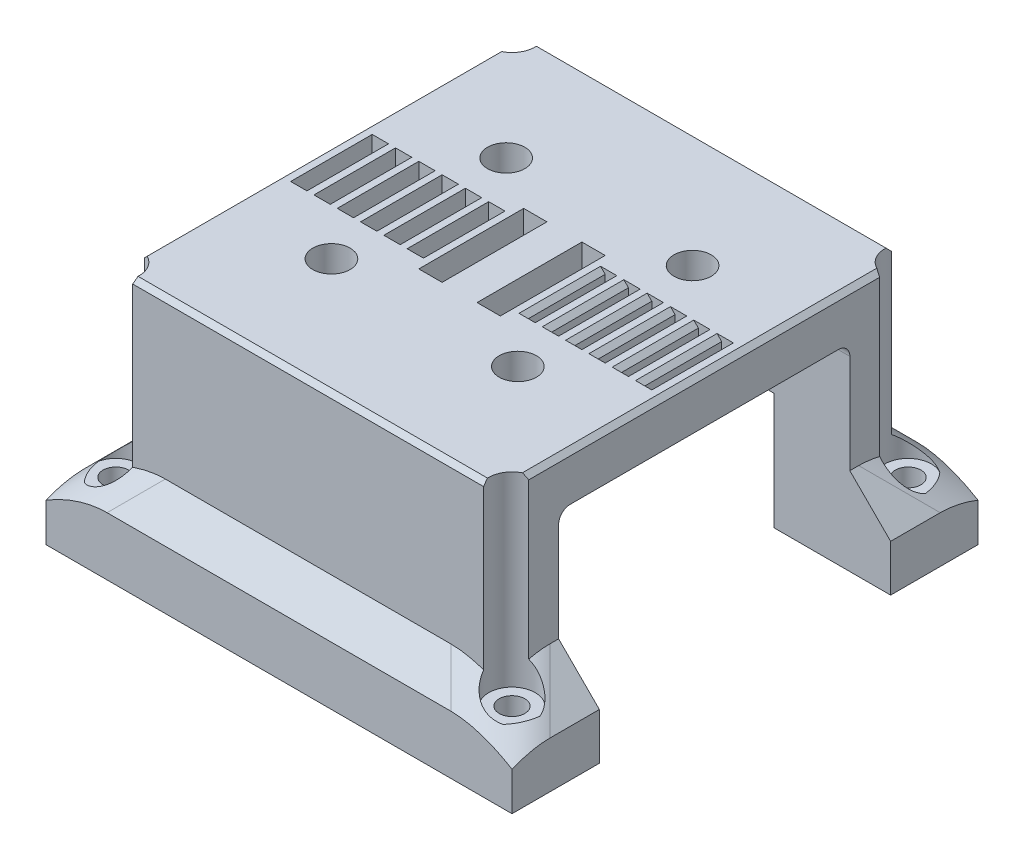
from build123d import *
from build123d.topology import SkipClean

# Parameters (mm, degrees)
SKETCH_1_W          = 33
SKETCH_1_H          = 35
SKETCH_1_R          = 1.6
EXTRUDE_1_DEPTH     = 4
SKETCH_2_W          = 1
SKETCH_2_H          = 7
CUT_EXTRUDE_1_DEPTH = 1.5
CHAMFER_1_SIZE      = 0.4
SKETCH_3_W          = 2
SKETCH_3_H          = 9
CUT_EXTRUDE_2_DEPTH = 49.270073545
SKETCH_4_W          = 3
SKETCH_4_H          = 7
EXTRUDE_2_DEPTH     = 1.5
SKETCH_5_W          = 33
SKETCH_5_H          = 5
EXTRUDE_3_DEPTH     = 13
SKETCH_7_W          = 40
SKETCH_7_H          = 7.5
EXTRUDE_4_DEPTH     = 4
CHAMFER_4_SIZE      = 3.5
SKETCH_8_R          = 1.1
CUT_EXTRUDE_3_DEPTH = 10
FILLET_1_R          = 1
SKETCH_9_W          = 20
SKETCH_9_H          = 7.5
CUT_EXTRUDE_4_DEPTH = 10
SKETCH_10_R         = 2
CUT_EXTRUDE_5_DEPTH = 16
CHAMFER_3_SIZE      = 0.4
FILLET_2_R          = 6


with BuildPart() as part:
    # 草图1 → 凸台-拉伸1 (new body)
    with BuildSketch(Plane(origin=(0, 0, 0), x_dir=(1, 0, 0), z_dir=(0, 1, 0))):
        with Locations((16.5, -17.5)):
            Rectangle(SKETCH_1_W, SKETCH_1_H)
        with Locations(Location((8.5, -10, 0), (0, 0, 270))):
            Circle(SKETCH_1_R, mode=Mode.SUBTRACT)
        with Locations(Location((24.5, -10, 0), (0, 0, 270))):
            Circle(SKETCH_1_R, mode=Mode.SUBTRACT)
        with Locations(Location((24.5, -25, 0), (0, 0, 270))):
            Circle(SKETCH_1_R, mode=Mode.SUBTRACT)
        with Locations(Location((8.5, -25, 0), (0, 0, 270))):
            Circle(SKETCH_1_R, mode=Mode.SUBTRACT)
    extrude(amount=EXTRUDE_1_DEPTH)

    # 草图2 → 切除-拉伸1 (cut)
    with BuildSketch(Plane(origin=(0, 4, 0), x_dir=(1, 0, 0), z_dir=(0, 1, 0))):
        with Locations((1.5, -17.5)):
            Rectangle(SKETCH_2_W, SKETCH_2_H)
        with Locations((3.5, -17.5)):
            Rectangle(SKETCH_2_W, SKETCH_2_H)
        with Locations((5.5, -17.5)):
            Rectangle(SKETCH_2_W, SKETCH_2_H)
        with Locations((7.5, -17.5)):
            Rectangle(SKETCH_2_W, SKETCH_2_H)
        with Locations((9.5, -17.5)):
            Rectangle(SKETCH_2_W, SKETCH_2_H)
        with Locations((11.5, -17.5)):
            Rectangle(SKETCH_2_W, SKETCH_2_H)
        with Locations((13.5, -17.5)):
            Rectangle(SKETCH_2_W, SKETCH_2_H)
        with Locations((15.5, -17.5)):
            Rectangle(SKETCH_2_W, SKETCH_2_H)
        with Locations((17.5, -17.5)):
            Rectangle(SKETCH_2_W, SKETCH_2_H)
        with Locations((19.5, -17.5)):
            Rectangle(SKETCH_2_W, SKETCH_2_H)
        with Locations((21.5, -17.5)):
            Rectangle(SKETCH_2_W, SKETCH_2_H)
        with Locations((23.5, -17.5)):
            Rectangle(SKETCH_2_W, SKETCH_2_H)
        with Locations((25.5, -17.5)):
            Rectangle(SKETCH_2_W, SKETCH_2_H)
        with Locations((27.5, -17.5)):
            Rectangle(SKETCH_2_W, SKETCH_2_H)
        with Locations((29.5, -17.5)):
            Rectangle(SKETCH_2_W, SKETCH_2_H)
        with Locations((31.5, -17.5)):
            Rectangle(SKETCH_2_W, SKETCH_2_H)
    extrude(amount=-CUT_EXTRUDE_1_DEPTH, mode=Mode.SUBTRACT)

    # 倒角1
    chamfer_1_edges = [part.edges().sort_by_distance(p)[0] for p in [
        (14, 4, 17.5),
        (16, 4, 17.5),
        (17, 4, 17.5),
        (19, 4, 17.5),
        (21, 4, 17.5),
        (23, 4, 17.5),
        (25, 4, 17.5),
        (27, 4, 17.5),
        (29, 4, 17.5),
        (31, 4, 17.5),
        (2, 4, 17.5),
        (4, 4, 17.5),
        (6, 4, 17.5),
        (8, 4, 17.5),
        (10, 4, 17.5),
        (12, 4, 17.5),
    ]]
    chamfer(chamfer_1_edges, length=CHAMFER_1_SIZE)

    # 草图3 → 切除-拉伸2 (cut, through all)
    with BuildSketch(Plane(origin=(0, 4, 0), x_dir=(1, 0, 0), z_dir=(0, 1, 0))):
        with Locations((14, -17.5)):
            Rectangle(SKETCH_3_W, SKETCH_3_H)
        with Locations((19, -17.5)):
            Rectangle(SKETCH_3_W, SKETCH_3_H)
    extrude(amount=-CUT_EXTRUDE_2_DEPTH, mode=Mode.SUBTRACT)

    # 草图4 → 凸台-拉伸2 (add)
    with BuildSketch(Plane(origin=(0, 4, 0), x_dir=(1, 0, 0), z_dir=(0, 1, 0))):
        with Locations((16.5, -17.5)):
            Rectangle(SKETCH_4_W, SKETCH_4_H)
    extrude(amount=-EXTRUDE_2_DEPTH)

    # 草图5 → 凸台-拉伸3 (add)
    with BuildSketch(Plane(origin=(0, 0, 0), x_dir=(-1, 0, 0), z_dir=(0, -1, 0))):
        with Locations((-16.5, -32.5)):
            Rectangle(SKETCH_5_W, SKETCH_5_H)
        with Locations((-16.5, -2.5)):
            Rectangle(SKETCH_5_W, SKETCH_5_H)
    extrude(amount=EXTRUDE_3_DEPTH)

    # 草图7 → 凸台-拉伸4 (add)
    with BuildSketch(Plane(origin=(0, -13, 0), x_dir=(-1, 0, 0), z_dir=(0, -1, 0))):
        with Locations((-16.5, -33.75)):
            Rectangle(SKETCH_7_W, SKETCH_7_H)
        with Locations((-16.5, -1.25)):
            Rectangle(SKETCH_7_W, SKETCH_7_H)
    extrude(amount=EXTRUDE_4_DEPTH)

    # 倒角4
    # the kernel refuses this chamfer: 3.5 mm, written as the material it adds along each edge
    with BuildSketch(Plane(origin=(33, -13, 5), x_dir=(-0.027495876610586112, 0.9996219169112968, 0), z_dir=(0, 0, -1))) as chamfer_4_piece_1_section:
        Polygon((CHAMFER_4_SIZE * 0.999621916911, CHAMFER_4_SIZE * 0.0274958766106), (-CHAMFER_4_SIZE * 0.0274958766106, CHAMFER_4_SIZE * 0.999621916911), (0, 0), align=None)
    chamfer_4_piece_1 = extrude(amount=5, mode=Mode.PRIVATE)
    chamfer_4_piece_1 = split(chamfer_4_piece_1, bisect_by=Plane(origin=(36.5, -11.84358546, 2.5), z_dir=(-1, 0, 0)), keep=Keep.TOP, mode=Mode.PRIVATE)
    add(chamfer_4_piece_1)
    with BuildSketch(Plane(origin=(33, -13, 0), x_dir=(0, 0.9996219169112968, 0.02749587661058637), z_dir=(-1, 0, 0))) as chamfer_4_piece_2_section:
        Polygon((CHAMFER_4_SIZE * 0.999621916911, CHAMFER_4_SIZE * 0.0274958766106), (-CHAMFER_4_SIZE * 0.0274958766106, CHAMFER_4_SIZE * 0.999621916911), (0, 0), align=None)
    chamfer_4_piece_2 = extrude(amount=33, mode=Mode.PRIVATE)
    chamfer_4_piece_2 = split(chamfer_4_piece_2, bisect_by=Plane(origin=(16.5, -11.750880098, -2.5), z_dir=(0, 0, 1)), keep=Keep.TOP, mode=Mode.PRIVATE)
    add(chamfer_4_piece_2)
    with BuildSketch(Plane(origin=(0, -13, 0), x_dir=(0.027495876610586126, 0.9996219169112968, 0), z_dir=(0, 0, 1))) as chamfer_4_piece_3_section:
        Polygon((CHAMFER_4_SIZE * 0.999621916911, CHAMFER_4_SIZE * 0.0274958766106), (-CHAMFER_4_SIZE * 0.0274958766106, CHAMFER_4_SIZE * 0.999621916911), (0, 0), align=None)
    chamfer_4_piece_3 = extrude(amount=5, mode=Mode.PRIVATE)
    chamfer_4_piece_3 = split(chamfer_4_piece_3, bisect_by=Plane(origin=(-3.5, -11.84358546, 2.5), z_dir=(1, 0, 0)), keep=Keep.TOP, mode=Mode.PRIVATE)
    add(chamfer_4_piece_3)
    with BuildSketch(Plane(origin=(33, -13, 35), x_dir=(0.9996219169112968, -0.02749587661058662, 0), z_dir=(0, 0, -1))) as chamfer_4_piece_4_section:
        Polygon((CHAMFER_4_SIZE * 0.999621916911, -CHAMFER_4_SIZE * 0.0274958766106), (-CHAMFER_4_SIZE * 0.0274958766106, -CHAMFER_4_SIZE * 0.999621916911), (0, 0), align=None)
    chamfer_4_piece_4 = extrude(amount=5, mode=Mode.PRIVATE)
    chamfer_4_piece_4 = split(chamfer_4_piece_4, bisect_by=Plane(origin=(36.5, -11.84358546, 32.5), z_dir=(-1, 0, 0)), keep=Keep.TOP, mode=Mode.PRIVATE)
    add(chamfer_4_piece_4)
    with BuildSketch(Plane(origin=(0, -13, 30), x_dir=(-0.9996219169112968, -0.02749587661058612, 0), z_dir=(0, 0, 1))) as chamfer_4_piece_5_section:
        Polygon((CHAMFER_4_SIZE * 0.999621916911, -CHAMFER_4_SIZE * 0.0274958766106), (-CHAMFER_4_SIZE * 0.0274958766106, -CHAMFER_4_SIZE * 0.999621916911), (0, 0), align=None)
    chamfer_4_piece_5 = extrude(amount=5, mode=Mode.PRIVATE)
    chamfer_4_piece_5 = split(chamfer_4_piece_5, bisect_by=Plane(origin=(-3.5, -11.84358546, 32.5), z_dir=(1, 0, 0)), keep=Keep.TOP, mode=Mode.PRIVATE)
    add(chamfer_4_piece_5)
    with BuildSketch(Plane(origin=(0, -13, 35), x_dir=(0, -0.02749587661058662, 0.9996219169112968), z_dir=(1, 0, 0))) as chamfer_4_piece_6_section:
        Polygon((CHAMFER_4_SIZE * 0.999621916911, -CHAMFER_4_SIZE * 0.0274958766106), (-CHAMFER_4_SIZE * 0.0274958766106, -CHAMFER_4_SIZE * 0.999621916911), (0, 0), align=None)
    chamfer_4_piece_6 = extrude(amount=33, mode=Mode.PRIVATE)
    chamfer_4_piece_6 = split(chamfer_4_piece_6, bisect_by=Plane(origin=(16.5, -11.750880098, 37.5), z_dir=(0, 0, -1)), keep=Keep.TOP, mode=Mode.PRIVATE)
    add(chamfer_4_piece_6)
    with BuildSketch(Plane(origin=(33, -13, 5), x_dir=(-0.027495876610586112, 0.9996219169112968, 0), z_dir=(0, 0, -1))) as chamfer_4_piece_7a_section:
        Polygon((CHAMFER_4_SIZE * 0.999621916911, CHAMFER_4_SIZE * 0.0274958766106), (-CHAMFER_4_SIZE * 0.0274958766106, CHAMFER_4_SIZE * 0.999621916911), (0, 0), align=None)
    chamfer_4_piece_7a = extrude(amount=14.000890458, mode=Mode.PRIVATE)
    chamfer_4_piece_7a = split(chamfer_4_piece_7a, bisect_by=Plane(origin=(34.150220168, -11.84358546, 0), z_dir=(0, 0, -1)), keep=Keep.TOP, mode=Mode.PRIVATE)
    chamfer_4_piece_7a = split(chamfer_4_piece_7a, bisect_by=Plane(origin=(36.5, -11.84358546, -1.25), z_dir=(-1, 0, 0)), keep=Keep.TOP, mode=Mode.PRIVATE)
    chamfer_4_piece_7a = split(chamfer_4_piece_7a, bisect_by=Plane(origin=(34.150220168, -11.84358546, -2.5), z_dir=(0, 0, 1)), keep=Keep.TOP, mode=Mode.PRIVATE)
    with BuildSketch(Plane(origin=(42.000890458, -13, 0), x_dir=(0, 0.9996219169112968, 0.02749587661058637), z_dir=(-1, 0, 0))) as chamfer_4_piece_7b_section:
        Polygon((CHAMFER_4_SIZE * 0.999621916911, CHAMFER_4_SIZE * 0.0274958766106), (-CHAMFER_4_SIZE * 0.0274958766106, CHAMFER_4_SIZE * 0.999621916911), (0, 0), align=None)
    chamfer_4_piece_7b = extrude(amount=42.000890458, mode=Mode.PRIVATE)
    chamfer_4_piece_7b = split(chamfer_4_piece_7b, bisect_by=Plane(origin=(33, -11.750880098, -0.973158105), z_dir=(1, 0, 0)), keep=Keep.TOP, mode=Mode.PRIVATE)
    chamfer_4_piece_7b = split(chamfer_4_piece_7b, bisect_by=Plane(origin=(36.5, -11.750880098, -0.973158105), z_dir=(-1, 0, 0)), keep=Keep.TOP, mode=Mode.PRIVATE)
    chamfer_4_piece_7b = split(chamfer_4_piece_7b, bisect_by=Plane(origin=(34.75, -11.750880098, -2.5), z_dir=(0, 0, 1)), keep=Keep.TOP, mode=Mode.PRIVATE)
    chamfer_4_piece_7 = chamfer_4_piece_7a & chamfer_4_piece_7b
    add(chamfer_4_piece_7)
    with BuildSketch(Plane(origin=(0, -13, -9.000890458), x_dir=(0.02749587661058636, 0.9996219169112968, 0), z_dir=(0, 0, 1))) as chamfer_4_piece_8a_section:
        Polygon((CHAMFER_4_SIZE * 0.999621916911, CHAMFER_4_SIZE * 0.0274958766106), (-CHAMFER_4_SIZE * 0.0274958766106, CHAMFER_4_SIZE * 0.999621916911), (0, 0), align=None)
    chamfer_4_piece_8a = extrude(amount=14.000890458, mode=Mode.PRIVATE)
    chamfer_4_piece_8a = split(chamfer_4_piece_8a, bisect_by=Plane(origin=(-1.150220168, -11.84358546, 0), z_dir=(0, 0, -1)), keep=Keep.TOP, mode=Mode.PRIVATE)
    chamfer_4_piece_8a = split(chamfer_4_piece_8a, bisect_by=Plane(origin=(-3.5, -11.84358546, -1.25), z_dir=(1, 0, 0)), keep=Keep.TOP, mode=Mode.PRIVATE)
    chamfer_4_piece_8a = split(chamfer_4_piece_8a, bisect_by=Plane(origin=(-1.150220168, -11.84358546, -2.5), z_dir=(0, 0, 1)), keep=Keep.TOP, mode=Mode.PRIVATE)
    with BuildSketch(Plane(origin=(33, -13, 0), x_dir=(0, 0.9996219169112968, 0.02749587661058637), z_dir=(-1, 0, 0))) as chamfer_4_piece_8b_section:
        Polygon((CHAMFER_4_SIZE * 0.999621916911, CHAMFER_4_SIZE * 0.0274958766106), (-CHAMFER_4_SIZE * 0.0274958766106, CHAMFER_4_SIZE * 0.999621916911), (0, 0), align=None)
    chamfer_4_piece_8b = extrude(amount=42.000890458, mode=Mode.PRIVATE)
    chamfer_4_piece_8b = split(chamfer_4_piece_8b, bisect_by=Plane(origin=(0, -11.750880098, -0.973158105), z_dir=(-1, 0, 0)), keep=Keep.TOP, mode=Mode.PRIVATE)
    chamfer_4_piece_8b = split(chamfer_4_piece_8b, bisect_by=Plane(origin=(-3.5, -11.750880098, -0.973158105), z_dir=(1, 0, 0)), keep=Keep.TOP, mode=Mode.PRIVATE)
    chamfer_4_piece_8b = split(chamfer_4_piece_8b, bisect_by=Plane(origin=(-1.75, -11.750880098, -2.5), z_dir=(0, 0, 1)), keep=Keep.TOP, mode=Mode.PRIVATE)
    chamfer_4_piece_8 = chamfer_4_piece_8a & chamfer_4_piece_8b
    add(chamfer_4_piece_8)
    with BuildSketch(Plane(origin=(0, -13, 35), x_dir=(0, -0.02749587661058662, 0.9996219169112968), z_dir=(1, 0, 0))) as chamfer_4_piece_9a_section:
        Polygon((CHAMFER_4_SIZE * 0.999621916911, -CHAMFER_4_SIZE * 0.0274958766106), (-CHAMFER_4_SIZE * 0.0274958766106, -CHAMFER_4_SIZE * 0.999621916911), (0, 0), align=None)
    chamfer_4_piece_9a = extrude(amount=42.000890458, mode=Mode.PRIVATE)
    chamfer_4_piece_9a = split(chamfer_4_piece_9a, bisect_by=Plane(origin=(34.75, -11.750880098, 37.5), z_dir=(0, 0, -1)), keep=Keep.TOP, mode=Mode.PRIVATE)
    chamfer_4_piece_9a = split(chamfer_4_piece_9a, bisect_by=Plane(origin=(36.5, -11.750880098, 35.973158105), z_dir=(-1, 0, 0)), keep=Keep.TOP, mode=Mode.PRIVATE)
    chamfer_4_piece_9a = split(chamfer_4_piece_9a, bisect_by=Plane(origin=(33, -11.750880098, 35.973158105), z_dir=(1, 0, 0)), keep=Keep.TOP, mode=Mode.PRIVATE)
    with BuildSketch(Plane(origin=(33, -13, 44.000890458), x_dir=(0.9996219169112968, -0.02749587661058662, 0), z_dir=(0, 0, -1))) as chamfer_4_piece_9b_section:
        Polygon((CHAMFER_4_SIZE * 0.999621916911, -CHAMFER_4_SIZE * 0.0274958766106), (-CHAMFER_4_SIZE * 0.0274958766106, -CHAMFER_4_SIZE * 0.999621916911), (0, 0), align=None)
    chamfer_4_piece_9b = extrude(amount=14.000890458, mode=Mode.PRIVATE)
    chamfer_4_piece_9b = split(chamfer_4_piece_9b, bisect_by=Plane(origin=(34.150220168, -11.84358546, 37.5), z_dir=(0, 0, -1)), keep=Keep.TOP, mode=Mode.PRIVATE)
    chamfer_4_piece_9b = split(chamfer_4_piece_9b, bisect_by=Plane(origin=(36.5, -11.84358546, 36.25), z_dir=(-1, 0, 0)), keep=Keep.TOP, mode=Mode.PRIVATE)
    chamfer_4_piece_9b = split(chamfer_4_piece_9b, bisect_by=Plane(origin=(34.150220168, -11.84358546, 35), z_dir=(0, 0, 1)), keep=Keep.TOP, mode=Mode.PRIVATE)
    chamfer_4_piece_9 = chamfer_4_piece_9a & chamfer_4_piece_9b
    add(chamfer_4_piece_9)
    with BuildSketch(Plane(origin=(0, -13, 30), x_dir=(-0.9996219169112968, -0.02749587661058612, 0), z_dir=(0, 0, 1))) as chamfer_4_piece_10a_section:
        Polygon((CHAMFER_4_SIZE * 0.999621916911, -CHAMFER_4_SIZE * 0.0274958766106), (-CHAMFER_4_SIZE * 0.0274958766106, -CHAMFER_4_SIZE * 0.999621916911), (0, 0), align=None)
    chamfer_4_piece_10a = extrude(amount=14.000890458, mode=Mode.PRIVATE)
    chamfer_4_piece_10a = split(chamfer_4_piece_10a, bisect_by=Plane(origin=(-1.150220168, -11.84358546, 37.5), z_dir=(0, 0, -1)), keep=Keep.TOP, mode=Mode.PRIVATE)
    chamfer_4_piece_10a = split(chamfer_4_piece_10a, bisect_by=Plane(origin=(-3.5, -11.84358546, 36.25), z_dir=(1, 0, 0)), keep=Keep.TOP, mode=Mode.PRIVATE)
    chamfer_4_piece_10a = split(chamfer_4_piece_10a, bisect_by=Plane(origin=(-1.150220168, -11.84358546, 35), z_dir=(0, 0, 1)), keep=Keep.TOP, mode=Mode.PRIVATE)
    with BuildSketch(Plane(origin=(-9.000890458, -13, 35), x_dir=(0, -0.02749587661058662, 0.9996219169112968), z_dir=(1, 0, 0))) as chamfer_4_piece_10b_section:
        Polygon((CHAMFER_4_SIZE * 0.999621916911, -CHAMFER_4_SIZE * 0.0274958766106), (-CHAMFER_4_SIZE * 0.0274958766106, -CHAMFER_4_SIZE * 0.999621916911), (0, 0), align=None)
    chamfer_4_piece_10b = extrude(amount=42.000890458, mode=Mode.PRIVATE)
    chamfer_4_piece_10b = split(chamfer_4_piece_10b, bisect_by=Plane(origin=(-1.75, -11.750880098, 37.5), z_dir=(0, 0, -1)), keep=Keep.TOP, mode=Mode.PRIVATE)
    chamfer_4_piece_10b = split(chamfer_4_piece_10b, bisect_by=Plane(origin=(-3.5, -11.750880098, 35.973158105), z_dir=(1, 0, 0)), keep=Keep.TOP, mode=Mode.PRIVATE)
    chamfer_4_piece_10b = split(chamfer_4_piece_10b, bisect_by=Plane(origin=(0, -11.750880098, 35.973158105), z_dir=(-1, 0, 0)), keep=Keep.TOP, mode=Mode.PRIVATE)
    chamfer_4_piece_10 = chamfer_4_piece_10a & chamfer_4_piece_10b
    add(chamfer_4_piece_10)

    # 草图8 → 切除-拉伸3 (cut)
    with BuildSketch(Plane(origin=(0, -17, 0), x_dir=(-1, 0, 0), z_dir=(0, -1, 0))):
        with Locations(Location((0.5, -34.5, 0), (0, 0, 90))):
            Circle(SKETCH_8_R)
        with Locations(Location((-33.5, -34.5, 0), (0, 0, 90))):
            Circle(SKETCH_8_R)
        with Locations(Location((-33.5, -0.5, 0), (0, 0, 90))):
            Circle(SKETCH_8_R)
        with Locations(Location((0.5, -0.5, 0), (0, 0, 90))):
            Circle(SKETCH_8_R)
    extrude(amount=-CUT_EXTRUDE_3_DEPTH, mode=Mode.SUBTRACT)

    # 圆角1
    fillet_1_edges = [part.edges().sort_by_distance(p)[0] for p in [
        (16.5, 0, 30),
        (16.5, 0, 5),
    ]]
    fillet(fillet_1_edges, radius=FILLET_1_R)

    # 草图9 → 切除-拉伸4 (cut)
    with BuildSketch(Plane(origin=(0, -17, 0), x_dir=(-1, 0, 0), z_dir=(0, -1, 0))):
        with Locations((-16.5, -1.25)):
            Rectangle(SKETCH_9_W, SKETCH_9_H)
    extrude(amount=-CUT_EXTRUDE_4_DEPTH, mode=Mode.SUBTRACT)

    # 草图10 → 切除-拉伸5 (cut)
    with SkipClean():  # the faces are left unmerged after this step: merging them gives an invalid solid
        with BuildSketch(Plane(origin=(0, 4, 0), x_dir=(1, 0, 0), z_dir=(0, 1, 0))):
            with Locations((33.5, -0.5)):
                Circle(SKETCH_10_R)
            with Locations((33.5, -34.5)):
                Circle(SKETCH_10_R)
            with Locations((-0.5, -34.5)):
                Circle(SKETCH_10_R)
            with Locations((-0.5, -0.5)):
                Circle(SKETCH_10_R)
        extrude(amount=-CUT_EXTRUDE_5_DEPTH, mode=Mode.SUBTRACT)

    # 倒角3
    chamfer_3_edges = [part.edges().sort_by_distance(p)[0] for p in [
        (16.5, 4, 0),
        (33, 4, 17.5),
        (16.5, 4, 35),
        (0, 4, 17.5),
    ]]
    chamfer(chamfer_3_edges, length=CHAMFER_3_SIZE)

    # 圆角2
    # the kernel refuses this fillet: 6 mm, written as the material it takes off along each edge
    with BuildSketch(Plane(origin=(3.677124344, -5.822875656, 3.677124344), x_dir=(-0.408248290464135, -0.4082482904638086, 0.8164965809276172), z_dir=(-0.5773502691897797, -0.5773502691893181, -0.5773502691897797))) as fillet_2_piece_1_section:
        with BuildLine():
            CenterArc((FILLET_2_R * 0.577350269189, -FILLET_2_R), FILLET_2_R, 90, 60)
            Line((-FILLET_2_R * 0.288675134595, -FILLET_2_R * 0.5), (0, 0))
            Line((0, 0), (FILLET_2_R * 0.577350269189, 0))
        make_face()
    fillet_2_piece_1 = extrude(amount=19.359347247, mode=Mode.PRIVATE)
    fillet_2_piece_1 = split(fillet_2_piece_1, bisect_by=Plane(origin=(0, -10.71116156, -1.124690628), z_dir=(1, 0, 0)), keep=Keep.TOP, mode=Mode.PRIVATE)
    fillet_2_piece_1 = split(fillet_2_piece_1, bisect_by=Plane(origin=(1.124690628, -10.71116156, 0), z_dir=(0, 0, -1)), keep=Keep.TOP, mode=Mode.PRIVATE)
    add(fillet_2_piece_1, mode=Mode.SUBTRACT)
    with BuildSketch(Plane(origin=(3.677124344, -5.822875656, 3.677124344), x_dir=(-0.408248290464135, -0.4082482904638086, 0.8164965809276172), z_dir=(-0.5773502691897797, -0.5773502691893181, -0.5773502691897797))) as fillet_2_piece_2_section:
        with BuildLine():
            CenterArc((FILLET_2_R * 0.577350269189, -FILLET_2_R), FILLET_2_R, 90, 60)
            Line((-FILLET_2_R * 0.288675134595, -FILLET_2_R * 0.5), (0, 0))
            Line((0, 0), (FILLET_2_R * 0.577350269189, 0))
        make_face()
    fillet_2_piece_2 = extrude(amount=19.359347247, mode=Mode.PRIVATE)
    fillet_2_piece_2 = split(fillet_2_piece_2, bisect_by=Plane(origin=(0, -10.71116156, 1.124690628), z_dir=(-1, 0, 0)), keep=Keep.TOP, mode=Mode.PRIVATE)
    fillet_2_piece_2 = split(fillet_2_piece_2, bisect_by=Plane(origin=(-1.124690628, -10.71116156, 0), z_dir=(0, 0, 1)), keep=Keep.TOP, mode=Mode.PRIVATE)
    add(fillet_2_piece_2, mode=Mode.SUBTRACT)
    with BuildSketch(Plane(origin=(3.677124344, -5.822875656, 3.677124344), x_dir=(-0.408248290464135, -0.4082482904638086, 0.8164965809276172), z_dir=(-0.5773502691897797, -0.5773502691893181, -0.5773502691897797))) as fillet_2_piece_3_section:
        with BuildLine():
            CenterArc((FILLET_2_R * 0.577350269189, -FILLET_2_R), FILLET_2_R, 90, 60)
            Line((-FILLET_2_R * 0.288675134595, -FILLET_2_R * 0.5), (0, 0))
            Line((0, 0), (FILLET_2_R * 0.577350269189, 0))
        make_face()
    fillet_2_piece_3 = extrude(amount=19.359347247, mode=Mode.PRIVATE)
    fillet_2_piece_3 = split(fillet_2_piece_3, bisect_by=Plane(origin=(0, -14.30507104, -3.927964613), z_dir=(-1, 0, 0)), keep=Keep.TOP, mode=Mode.PRIVATE)
    fillet_2_piece_3 = split(fillet_2_piece_3, bisect_by=Plane(origin=(-3.927964613, -14.30507104, 0), z_dir=(0, 0, -1)), keep=Keep.TOP, mode=Mode.PRIVATE)
    add(fillet_2_piece_3, mode=Mode.SUBTRACT)
    with BuildSketch(Plane(origin=(-7.5, -17, 42.5), x_dir=(-0.40824829046359146, -0.4082482904639171, -0.816496580927835), z_dir=(0.577350269189472, 0.5773502691899335, -0.577350269189472))) as fillet_2_piece_4_section:
        with BuildLine():
            CenterArc((FILLET_2_R * 0.57735026919, -FILLET_2_R), FILLET_2_R, 90, 60)
            Line((-FILLET_2_R * 0.288675134595, -FILLET_2_R * 0.5), (0, 0))
            Line((0, 0), (FILLET_2_R * 0.57735026919, 0))
        make_face()
    fillet_2_piece_4 = extrude(amount=19.359347247, mode=Mode.PRIVATE)
    fillet_2_piece_4 = split(fillet_2_piece_4, bisect_by=Plane(origin=(0, -14.30507104, 38.927964613), z_dir=(-1, 0, 0)), keep=Keep.TOP, mode=Mode.PRIVATE)
    fillet_2_piece_4 = split(fillet_2_piece_4, bisect_by=Plane(origin=(-3.927964613, -14.30507104, 35), z_dir=(0, 0, 1)), keep=Keep.TOP, mode=Mode.PRIVATE)
    add(fillet_2_piece_4, mode=Mode.SUBTRACT)
    with BuildSketch(Plane(origin=(-7.5, -17, 42.5), x_dir=(-0.40824829046359146, -0.4082482904639171, -0.816496580927835), z_dir=(0.577350269189472, 0.5773502691899335, -0.577350269189472))) as fillet_2_piece_5_section:
        with BuildLine():
            CenterArc((FILLET_2_R * 0.57735026919, -FILLET_2_R), FILLET_2_R, 90, 60)
            Line((-FILLET_2_R * 0.288675134595, -FILLET_2_R * 0.5), (0, 0))
            Line((0, 0), (FILLET_2_R * 0.57735026919, 0))
        make_face()
    fillet_2_piece_5 = extrude(amount=19.359347247, mode=Mode.PRIVATE)
    fillet_2_piece_5 = split(fillet_2_piece_5, bisect_by=Plane(origin=(0, -10.71116156, 36.124690628), z_dir=(1, 0, 0)), keep=Keep.TOP, mode=Mode.PRIVATE)
    fillet_2_piece_5 = split(fillet_2_piece_5, bisect_by=Plane(origin=(1.124690628, -10.71116156, 35), z_dir=(0, 0, 1)), keep=Keep.TOP, mode=Mode.PRIVATE)
    add(fillet_2_piece_5, mode=Mode.SUBTRACT)
    with BuildSketch(Plane(origin=(-7.5, -17, 42.5), x_dir=(-0.40824829046359146, -0.4082482904639171, -0.816496580927835), z_dir=(0.577350269189472, 0.5773502691899335, -0.577350269189472))) as fillet_2_piece_6_section:
        with BuildLine():
            CenterArc((FILLET_2_R * 0.57735026919, -FILLET_2_R), FILLET_2_R, 90, 60)
            Line((-FILLET_2_R * 0.288675134595, -FILLET_2_R * 0.5), (0, 0))
            Line((0, 0), (FILLET_2_R * 0.57735026919, 0))
        make_face()
    fillet_2_piece_6 = extrude(amount=19.359347247, mode=Mode.PRIVATE)
    fillet_2_piece_6 = split(fillet_2_piece_6, bisect_by=Plane(origin=(0, -10.71116156, 33.875309372), z_dir=(-1, 0, 0)), keep=Keep.TOP, mode=Mode.PRIVATE)
    fillet_2_piece_6 = split(fillet_2_piece_6, bisect_by=Plane(origin=(-1.124690628, -10.71116156, 35), z_dir=(0, 0, -1)), keep=Keep.TOP, mode=Mode.PRIVATE)
    add(fillet_2_piece_6, mode=Mode.SUBTRACT)
    with BuildSketch(Plane(origin=(40.5, -17, 42.5), x_dir=(-0.8164965809278348, -0.40824829046391836, 0.4082482904635902), z_dir=(-0.577350269189472, 0.5773502691899335, -0.577350269189472))) as fillet_2_piece_7_section:
        with BuildLine():
            CenterArc((FILLET_2_R * 0.57735026919, -FILLET_2_R), FILLET_2_R, 90, 60)
            Line((-FILLET_2_R * 0.288675134595, -FILLET_2_R * 0.5), (0, 0))
            Line((0, 0), (FILLET_2_R * 0.57735026919, 0))
        make_face()
    fillet_2_piece_7 = extrude(amount=19.359347247, mode=Mode.PRIVATE)
    fillet_2_piece_7 = split(fillet_2_piece_7, bisect_by=Plane(origin=(33, -14.30507104, 38.927964613), z_dir=(1, 0, 0)), keep=Keep.TOP, mode=Mode.PRIVATE)
    fillet_2_piece_7 = split(fillet_2_piece_7, bisect_by=Plane(origin=(36.927964613, -14.30507104, 35), z_dir=(0, 0, 1)), keep=Keep.TOP, mode=Mode.PRIVATE)
    add(fillet_2_piece_7, mode=Mode.SUBTRACT)
    with BuildSketch(Plane(origin=(40.5, -17, 42.5), x_dir=(-0.8164965809278348, -0.40824829046391836, 0.4082482904635902), z_dir=(-0.577350269189472, 0.5773502691899335, -0.577350269189472))) as fillet_2_piece_8_section:
        with BuildLine():
            CenterArc((FILLET_2_R * 0.57735026919, -FILLET_2_R), FILLET_2_R, 90, 60)
            Line((-FILLET_2_R * 0.288675134595, -FILLET_2_R * 0.5), (0, 0))
            Line((0, 0), (FILLET_2_R * 0.57735026919, 0))
        make_face()
    fillet_2_piece_8 = extrude(amount=19.359347247, mode=Mode.PRIVATE)
    fillet_2_piece_8 = split(fillet_2_piece_8, bisect_by=Plane(origin=(33, -10.71116156, 33.875309372), z_dir=(1, 0, 0)), keep=Keep.TOP, mode=Mode.PRIVATE)
    fillet_2_piece_8 = split(fillet_2_piece_8, bisect_by=Plane(origin=(34.124690628, -10.71116156, 35), z_dir=(0, 0, -1)), keep=Keep.TOP, mode=Mode.PRIVATE)
    add(fillet_2_piece_8, mode=Mode.SUBTRACT)
    with BuildSketch(Plane(origin=(40.5, -17, 42.5), x_dir=(-0.8164965809278348, -0.40824829046391836, 0.4082482904635902), z_dir=(-0.577350269189472, 0.5773502691899335, -0.577350269189472))) as fillet_2_piece_9_section:
        with BuildLine():
            CenterArc((FILLET_2_R * 0.57735026919, -FILLET_2_R), FILLET_2_R, 90, 60)
            Line((-FILLET_2_R * 0.288675134595, -FILLET_2_R * 0.5), (0, 0))
            Line((0, 0), (FILLET_2_R * 0.57735026919, 0))
        make_face()
    fillet_2_piece_9 = extrude(amount=19.359347247, mode=Mode.PRIVATE)
    fillet_2_piece_9 = split(fillet_2_piece_9, bisect_by=Plane(origin=(33, -10.71116156, 36.124690628), z_dir=(-1, 0, 0)), keep=Keep.TOP, mode=Mode.PRIVATE)
    fillet_2_piece_9 = split(fillet_2_piece_9, bisect_by=Plane(origin=(31.875309372, -10.71116156, 35), z_dir=(0, 0, 1)), keep=Keep.TOP, mode=Mode.PRIVATE)
    add(fillet_2_piece_9, mode=Mode.SUBTRACT)
    with BuildSketch(Plane(origin=(40.5, -17, -7.5), x_dir=(0.40824829046413486, -0.4082482904638087, 0.8164965809276172), z_dir=(-0.5773502691897797, 0.5773502691893181, 0.5773502691897797))) as fillet_2_piece_10_section:
        with BuildLine():
            CenterArc((FILLET_2_R * 0.577350269189, -FILLET_2_R), FILLET_2_R, 90, 60)
            Line((-FILLET_2_R * 0.288675134595, -FILLET_2_R * 0.5), (0, 0))
            Line((0, 0), (FILLET_2_R * 0.577350269189, 0))
        make_face()
    fillet_2_piece_10 = extrude(amount=19.359347247, mode=Mode.PRIVATE)
    fillet_2_piece_10 = split(fillet_2_piece_10, bisect_by=Plane(origin=(33, -14.30507104, -3.927964613), z_dir=(1, 0, 0)), keep=Keep.TOP, mode=Mode.PRIVATE)
    fillet_2_piece_10 = split(fillet_2_piece_10, bisect_by=Plane(origin=(36.927964613, -14.30507104, 0), z_dir=(0, 0, -1)), keep=Keep.TOP, mode=Mode.PRIVATE)
    add(fillet_2_piece_10, mode=Mode.SUBTRACT)
    with BuildSketch(Plane(origin=(40.5, -17, -7.5), x_dir=(0.40824829046413486, -0.4082482904638087, 0.8164965809276172), z_dir=(-0.5773502691897797, 0.5773502691893181, 0.5773502691897797))) as fillet_2_piece_11_section:
        with BuildLine():
            CenterArc((FILLET_2_R * 0.577350269189, -FILLET_2_R), FILLET_2_R, 90, 60)
            Line((-FILLET_2_R * 0.288675134595, -FILLET_2_R * 0.5), (0, 0))
            Line((0, 0), (FILLET_2_R * 0.577350269189, 0))
        make_face()
    fillet_2_piece_11 = extrude(amount=19.359347247, mode=Mode.PRIVATE)
    fillet_2_piece_11 = split(fillet_2_piece_11, bisect_by=Plane(origin=(33, -10.71116156, -1.124690628), z_dir=(-1, 0, 0)), keep=Keep.TOP, mode=Mode.PRIVATE)
    fillet_2_piece_11 = split(fillet_2_piece_11, bisect_by=Plane(origin=(31.875309372, -10.71116156, 0), z_dir=(0, 0, -1)), keep=Keep.TOP, mode=Mode.PRIVATE)
    add(fillet_2_piece_11, mode=Mode.SUBTRACT)
    with BuildSketch(Plane(origin=(40.5, -17, -7.5), x_dir=(0.40824829046413486, -0.4082482904638087, 0.8164965809276172), z_dir=(-0.5773502691897797, 0.5773502691893181, 0.5773502691897797))) as fillet_2_piece_12_section:
        with BuildLine():
            CenterArc((FILLET_2_R * 0.577350269189, -FILLET_2_R), FILLET_2_R, 90, 60)
            Line((-FILLET_2_R * 0.288675134595, -FILLET_2_R * 0.5), (0, 0))
            Line((0, 0), (FILLET_2_R * 0.577350269189, 0))
        make_face()
    fillet_2_piece_12 = extrude(amount=19.359347247, mode=Mode.PRIVATE)
    fillet_2_piece_12 = split(fillet_2_piece_12, bisect_by=Plane(origin=(33, -10.71116156, 1.124690628), z_dir=(1, 0, 0)), keep=Keep.TOP, mode=Mode.PRIVATE)
    fillet_2_piece_12 = split(fillet_2_piece_12, bisect_by=Plane(origin=(34.124690628, -10.71116156, 0), z_dir=(0, 0, 1)), keep=Keep.TOP, mode=Mode.PRIVATE)
    add(fillet_2_piece_12, mode=Mode.SUBTRACT)


solid = part.part
